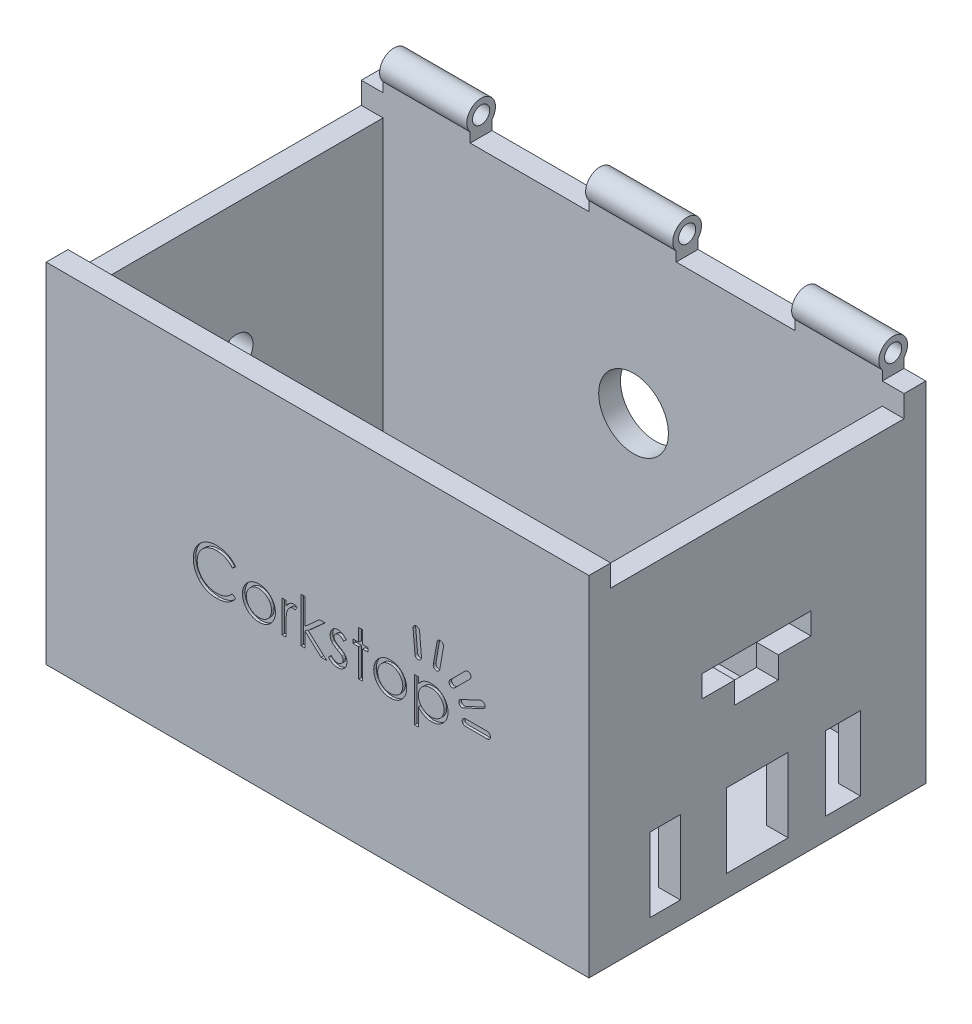
from build123d import *

# Parameters (mm, degrees)
SKETCH1_W                   = 158.2
SKETCH1_H                   = 98.2
BOSS_EXTRUDE1_DEPTH         = 6.35
SKETCH2_W                   = 158.2
SKETCH2_H                   = 95.25
BOSS_EXTRUDE2_DEPTH         = 6.35
SKETCH3_W                   = 85.5
SKETCH3_H                   = 95.25
BOSS_EXTRUDE3_DEPTH         = 6.35
SKETCH4_W                   = 158.2
SKETCH4_H                   = 95.25
BOSS_EXTRUDE4_DEPTH         = 6.35
SKETCH5_W                   = 85.5
SKETCH5_H                   = 73.66
BOSS_EXTRUDE5_DEPTH         = 6.35
SKETCH6_W                   = 13.462
SKETCH6_H                   = 21.59
SKETCH6_W_2                 = 10.922
SKETCH6_W_3                 = 11.43
SKETCH6_W_4                 = 12.7
BOSS_EXTRUDE6_DEPTH         = 6.35
KES_EKSTR_ZYON1_DEPTH       = 6.35
IZIM3_R                     = 10.16
KES_EKSTR_ZYON2_DEPTH       = 6.35
IZIM4_R                     = 4.826
KES_EKSTR_ZYON3_DEPTH       = 6.35
IZIM5_W                     = 85.5
IZIM5_H                     = 6.35
KES_EKSTR_ZYON4_DEPTH       = 6.35
IZIM6_W                     = 85.5
IZIM6_H                     = 6.35
KES_EKSTR_ZYON5_DEPTH       = 6.35
KES_EKSTR_ZYON6_DEPTH       = 0.762
KES_EKSTR_ZYON7_DEPTH       = 0.762
KES_EKSTR_ZYON8_DEPTH       = 0.762
KES_EKSTR_ZYON9_DEPTH       = 0.762
KES_EKSTR_ZYON12_DEPTH      = 0.762
KES_EKSTR_ZYON13_DEPTH      = 0.762
Y_KSEKLIK_EKSTR_ZYON2_DEPTH = 25.4
Y_KSEKLIK_EKSTR_ZYON3_DEPTH = 25.4
Y_KSEKLIK_EKSTR_ZYON4_DEPTH = 25.4
Y_KSEKLIK_EKSTR_ZYON5_DEPTH = 12.7
IZIM24_R                    = 2.5
KES_EKSTR_ZYON14_DEPTH      = 25.4
IZIM25_R                    = 2.5
KES_EKSTR_ZYON15_DEPTH      = 25.4
IZIM26_R                    = 2.5
KES_EKSTR_ZYON16_DEPTH      = 25.4


with BuildPart() as part:
    # Sketch1 → Boss-Extrude1 (new body)
    with BuildSketch(Plane(origin=(0, 0, 0), x_dir=(1, 0, 0), z_dir=(0, 1, 0))):
        Rectangle(SKETCH1_W, SKETCH1_H)
    extrude(amount=BOSS_EXTRUDE1_DEPTH)

    # Sketch2 → Boss-Extrude2 (add)
    with BuildSketch(Plane.XY.offset(49.1)):
        with Locations((0, 53.975)):
            Rectangle(SKETCH2_W, SKETCH2_H)
    extrude(amount=-BOSS_EXTRUDE2_DEPTH)

    # Sketch3 → Boss-Extrude3 (add)
    with BuildSketch(Plane.ZY.offset(79.1)):
        with Locations((0, 53.975)):
            Rectangle(SKETCH3_W, SKETCH3_H)
    extrude(amount=-BOSS_EXTRUDE3_DEPTH)

    # Sketch4 → Boss-Extrude4 (add)
    with BuildSketch(Plane(origin=(0, 0, -49.1), x_dir=(-1, 0, 0), z_dir=(0, 0, -1))):
        with Locations((0, 53.975)):
            Rectangle(SKETCH4_W, SKETCH4_H)
    extrude(amount=-BOSS_EXTRUDE4_DEPTH)

    # Sketch5 → Boss-Extrude5 (add)
    with BuildSketch(Plane(origin=(79.1, 0, 0), x_dir=(0, 0, -1), z_dir=(1, 0, 0))):
        with Locations((0, 64.77)):
            Rectangle(SKETCH5_W, SKETCH5_H)
    extrude(amount=-BOSS_EXTRUDE5_DEPTH)

    # Sketch6 → Boss-Extrude6 (add)
    with BuildSketch(Plane(origin=(79.1, 0, 0), x_dir=(0, 0, -1), z_dir=(1, 0, 0))):
        with Locations((-15.699, 17.145)):
            Rectangle(SKETCH6_W, SKETCH6_H)
        with Locations((14.429, 17.145)):
            Rectangle(SKETCH6_W_2, SKETCH6_H)
        with Locations((-37.035, 17.145)):
            Rectangle(SKETCH6_W_3, SKETCH6_H)
        with Locations((36.4, 17.145)):
            Rectangle(SKETCH6_W_4, SKETCH6_H)
    extrude(amount=-BOSS_EXTRUDE6_DEPTH)

    # Çizim2 → Kes-Ekstrüzyon1 (cut)
    with BuildSketch(Plane(origin=(79.1, 0, 0), x_dir=(0, 0, -1), z_dir=(1, 0, 0))):
        Polygon((-16.125, 60.325), (15.625, 60.325), (15.625, 53.975), (6.10000009, 53.975), (6.10000009, 47.625), (-6.59999991, 47.625), (-6.59999991, 53.975), (-16.125, 53.975), align=None)
    extrude(amount=-KES_EKSTR_ZYON1_DEPTH, mode=Mode.SUBTRACT)

    # Çizim3 → Kes-Ekstrüzyon2 (cut)
    with BuildSketch(Plane(origin=(0, 0, -49.1), x_dir=(-1, 0, 0), z_dir=(0, 0, -1))):
        with Locations((-0.250018, 57.15)):
            Circle(IZIM3_R)
    extrude(amount=-KES_EKSTR_ZYON2_DEPTH, mode=Mode.SUBTRACT)

    # Çizim4 → Kes-Ekstrüzyon3 (cut)
    with BuildSketch(Plane.ZY.offset(79.1)):
        with Locations((0, 57.15)):
            Circle(IZIM4_R)
    extrude(amount=-KES_EKSTR_ZYON3_DEPTH, mode=Mode.SUBTRACT)

    # Çizim5 → Kes-Ekstrüzyon4 (cut)
    with BuildSketch(Plane(origin=(79.1, 0, 0), x_dir=(0, 0, -1), z_dir=(1, 0, 0))):
        with Locations((0, 98.425)):
            Rectangle(IZIM5_W, IZIM5_H)
    extrude(amount=-KES_EKSTR_ZYON4_DEPTH, mode=Mode.SUBTRACT)

    # Çizim6 → Kes-Ekstrüzyon5 (cut)
    with BuildSketch(Plane.ZY.offset(79.1)):
        with Locations((0, 98.425)):
            Rectangle(IZIM6_W, IZIM6_H)
    extrude(amount=-KES_EKSTR_ZYON5_DEPTH, mode=Mode.SUBTRACT)

    # Çizim7 → Kes-Ekstrüzyon6 (cut)
    # profile 1 of 8: a face of its own
    with BuildSketch(Plane.XY.offset(49.1)):
        with BuildLine():
            Line((-23.838717949, 52.27963141), (-24.83599359, 51.516410256))
            add(Edge.make_bspline(
                [(-24.83599359, 51.516410256), (-24.907134956, 51.601195347), (-25.048458549, 51.769622441), (-25.275821941, 52.006131074), (-25.512773616, 52.227710737), (-25.759222999, 52.435416986), (-26.01960609, 52.621986393), (-26.287615274, 52.797141538), (-26.567733895, 52.954141615), (-26.955090189, 53.144507308), (-27.461812381, 53.343157642), (-28.099696512, 53.509720795), (-28.765579641, 53.615751919), (-29.219868074, 53.627235772), (-29.4509375, 53.633076923)],
                knots=[0, 0, 0, 0, 0.757959112, 1.505699292, 2.245454638, 2.979532153, 3.711538275, 4.438200793, 5.171680507, 5.909471876, 7.393775596, 8.890124382, 10.418191784, 12, 12, 12, 12], degree=3))
            add(Edge.make_bspline(
                [(-29.4509375, 53.633076923), (-29.578239758, 53.631611116), (-29.831662788, 53.628693107), (-30.207758677, 53.590197138), (-30.576831749, 53.536090747), (-30.938641926, 53.455807432), (-31.292728661, 53.354306785), (-31.641406806, 53.233020283), (-31.979628125, 53.082961293), (-32.312071447, 52.917105607), (-32.630584584, 52.729771736), (-32.931955757, 52.525434716), (-33.215085812, 52.306381138), (-33.480198719, 52.07178998), (-33.727565503, 51.822717724), (-33.955393745, 51.55650997), (-34.162895091, 51.274017797), (-34.354182582, 50.97896629), (-34.525497357, 50.672214875), (-34.668934348, 50.352628191), (-34.795952934, 50.025679017), (-34.896461615, 49.687673376), (-34.97601629, 49.340989626), (-35.030908097, 48.984697338), (-35.068966264, 48.619540843), (-35.071869763, 48.37203848), (-35.073333333, 48.247279647)],
                knots=[0, 0, 0, 0, 1.054917814, 2.100044995, 3.131103042, 4.146048494, 5.169673617, 6.183595914, 7.203665975, 8.234915748, 9.262203917, 10.264457458, 11.251630812, 12.227803204, 13.197192746, 14.159520551, 15.12972552, 16.100847026, 17.073214652, 18.039054194, 19.002613845, 19.979014051, 20.95965708, 21.949030935, 22.966165397, 24, 24, 24, 24], degree=3))
            add(Edge.make_bspline(
                [(-35.073333333, 48.247279647), (-35.068754733, 48.059568858), (-35.059765258, 47.691023622), (-34.979761303, 47.151198835), (-34.858185686, 46.63405239), (-34.675974878, 46.142816962), (-34.451297181, 45.671435206), (-34.167395533, 45.227882795), (-33.838586955, 44.805456975), (-33.460219776, 44.414141136), (-33.0450901, 44.056677047), (-32.599690535, 43.741896366), (-32.125130406, 43.479496649), (-31.62664949, 43.261143929), (-31.100411877, 43.093298089), (-30.54736388, 42.97513684), (-29.968708354, 42.898058071), (-29.573305103, 42.890678689), (-29.372071314, 42.886923077)],
                knots=[0, 0, 0, 0, 1.029171465, 2.020641659, 2.987623507, 3.938342917, 4.889210282, 5.84687017, 6.821220943, 7.821438502, 8.827599549, 9.822697543, 10.807740252, 11.797342354, 12.80366471, 13.83203677, 14.896651826, 16, 16, 16, 16], degree=3))
            add(Edge.make_bspline(
                [(-29.372071314, 42.886923077), (-29.150355843, 42.893050935), (-28.713966756, 42.905112025), (-28.074002775, 43.007289872), (-27.461370139, 43.172962888), (-26.876035897, 43.404821063), (-26.319650181, 43.706229394), (-25.791342299, 44.071618835), (-25.290666314, 44.504465071), (-24.98959909, 44.834966708), (-24.83599359, 45.003589744)],
                knots=[0, 0, 0, 0, 1.028121516, 2.023589091, 2.998037872, 3.967518031, 4.937445131, 5.927275754, 6.942489185, 8, 8, 8, 8], degree=3))
            Line((-24.83599359, 45.003589744), (-23.838717949, 44.248000801))
            add(Edge.make_bspline(
                [(-23.838717949, 44.248000801), (-23.91897509, 44.14444699), (-24.079104946, 43.937835384), (-24.338395465, 43.646563752), (-24.611544516, 43.372591966), (-24.900580949, 43.118128883), (-25.202179793, 42.87808268), (-25.521756469, 42.659273177), (-25.855109816, 42.458646254), (-26.201110353, 42.274942843), (-26.559390463, 42.111957403), (-26.929520841, 41.97242516), (-27.309906072, 41.852229133), (-27.700563545, 41.753343534), (-28.102303577, 41.676159886), (-28.51367644, 41.624562781), (-28.935569988, 41.589213548), (-29.220200287, 41.585991682), (-29.364439103, 41.584358974)],
                knots=[0, 0, 0, 0, 0.986787822, 1.968848986, 2.935600012, 3.899624008, 4.868462664, 5.837806735, 6.815139263, 7.798259679, 8.787526145, 9.778297419, 10.776456485, 11.791383307, 12.812564526, 13.85620153, 14.913611965, 16, 16, 16, 16], degree=3))
            add(Edge.make_bspline(
                [(-29.364439103, 41.584358974), (-29.501031837, 41.585309633), (-29.771127056, 41.587189443), (-30.169902526, 41.617641022), (-30.558121862, 41.65918721), (-30.934675504, 41.721744257), (-31.301618328, 41.795565148), (-31.655623877, 41.894520851), (-32.000175641, 42.005370684), (-32.333889334, 42.135654493), (-32.657048816, 42.282670355), (-32.968611789, 42.448828297), (-33.268434958, 42.632731064), (-33.559466056, 42.830324958), (-33.83740586, 43.047956882), (-34.104662938, 43.282604385), (-34.362735923, 43.533476595), (-34.522402809, 43.714378492), (-34.602680288, 43.805332532)],
                knots=[0, 0, 0, 0, 1.114604814, 2.203992996, 3.262667896, 4.300477797, 5.318619304, 6.316056647, 7.298880507, 8.271930387, 9.238335007, 10.195173496, 11.151986948, 12.108099108, 13.064862484, 14.031167946, 15.010108607, 16, 16, 16, 16], degree=3))
            add(Edge.make_bspline(
                [(-34.602680288, 43.805332532), (-34.731261052, 43.963324846), (-34.986870239, 44.277402052), (-35.31389772, 44.786439756), (-35.593833134, 45.317910114), (-35.820168618, 45.874605284), (-35.997107679, 46.455276089), (-36.119685158, 47.060215241), (-36.199338123, 47.688857774), (-36.208446885, 48.116436979), (-36.213076923, 48.333778045)],
                knots=[0, 0, 0, 0, 0.994628077, 1.977248131, 2.950237994, 3.925870899, 4.908910175, 5.911660606, 6.938484602, 8, 8, 8, 8], degree=3))
            add(Edge.make_bspline(
                [(-36.213076923, 48.333778045), (-36.207433792, 48.562216405), (-36.196331284, 49.011654617), (-36.102003684, 49.67123439), (-35.950261195, 50.30315518), (-35.734735342, 50.906237339), (-35.461484496, 51.483652928), (-35.123930783, 52.030991014), (-34.725995724, 52.551751972), (-34.270800264, 53.03803407), (-33.771627361, 53.482676864), (-33.237070522, 53.873859375), (-32.668176029, 54.19940579), (-32.071211253, 54.471534722), (-31.441706066, 54.680701774), (-30.781003555, 54.827126194), (-30.090345207, 54.918265445), (-29.619130119, 54.929786913), (-29.379703526, 54.935641026)],
                knots=[0, 0, 0, 0, 1.032925535, 2.032216505, 3.007276963, 3.968222605, 4.92396291, 5.891752235, 6.871517503, 7.883894988, 8.900124299, 9.891468569, 10.874487609, 11.85992873, 12.854644235, 13.869047385, 14.917252991, 16, 16, 16, 16], degree=3))
            add(Edge.make_bspline(
                [(-29.379703526, 54.935641026), (-29.233782442, 54.933891553), (-28.944946352, 54.930428647), (-28.517672441, 54.896660646), (-28.101684569, 54.840368418), (-27.696696149, 54.76374725), (-27.300736941, 54.668652112), (-26.91683321, 54.544771601), (-26.542732261, 54.403124759), (-26.18079348, 54.239989754), (-25.832753426, 54.056867578), (-25.498720499, 53.85578803), (-25.181348012, 53.637000393), (-24.878402762, 53.402365442), (-24.59495251, 53.146919241), (-24.322949431, 52.877687964), (-24.071630662, 52.586916659), (-23.91649764, 52.382247328), (-23.838717949, 52.27963141)],
                knots=[0, 0, 0, 0, 1.096760587, 2.17092713, 3.219439832, 4.250915756, 5.268269357, 6.278326846, 7.281116186, 8.274029601, 9.260640565, 10.235837813, 11.203064059, 12.156899882, 13.114053108, 14.069676657, 15.032185724, 16, 16, 16, 16], degree=3))
        make_face()
    # profile 2 of 8: a face of its own
    with BuildSketch(Plane.XY.offset(49.1)):
        with BuildLine():
            add(Edge.make_bspline(
                [(-17.076578526, 51.353589744), (-16.902438764, 51.349881739), (-16.56099325, 51.342611247), (-16.060947492, 51.264905514), (-15.58362657, 51.146079364), (-15.127202387, 50.981808267), (-14.697520401, 50.761619475), (-14.288321887, 50.49887719), (-13.90072874, 50.187608922), (-13.668416605, 49.946823931), (-13.550496795, 49.824603365)],
                knots=[0, 0, 0, 0, 1.054011418, 2.066658804, 3.057071809, 4.030435133, 4.997543892, 5.974964718, 6.972108034, 8, 8, 8, 8], degree=3))
            add(Edge.make_bspline(
                [(-13.550496795, 49.824603365), (-13.448962276, 49.707712617), (-13.24785821, 49.476193278), (-12.989991174, 49.100797197), (-12.76784437, 48.712031689), (-12.589815911, 48.304734246), (-12.44944454, 47.88246044), (-12.349783299, 47.443758856), (-12.290503564, 46.989598339), (-12.282509941, 46.681155841), (-12.278461538, 46.52494391)],
                knots=[0, 0, 0, 0, 1.025258237, 2.030674902, 3.01204498, 3.988269485, 4.97094183, 5.956517959, 6.965070386, 8, 8, 8, 8], degree=3))
            add(Edge.make_bspline(
                [(-12.278461538, 46.52494391), (-12.282022391, 46.367826558), (-12.289058802, 46.057355343), (-12.355619924, 45.600085073), (-12.459147007, 45.15669243), (-12.607308248, 44.729033742), (-12.797293388, 44.315801768), (-13.029125311, 43.918801403), (-13.304430893, 43.537249377), (-13.616502539, 43.174385564), (-13.961405061, 42.83995387), (-14.33556937, 42.548477006), (-14.731642579, 42.298753189), (-15.154891318, 42.097598196), (-15.601450484, 41.938994426), (-16.072283274, 41.827597223), (-16.566658244, 41.760244828), (-16.904214161, 41.751595862), (-17.076578526, 41.747179487)],
                knots=[0, 0, 0, 0, 0.998656419, 1.973391657, 2.932242238, 3.890759089, 4.846373663, 5.82037756, 6.809684879, 7.83454468, 8.860553229, 9.859544525, 10.845671541, 11.83227036, 12.833544569, 13.85385346, 14.904124723, 16, 16, 16, 16], degree=3))
            add(Edge.make_bspline(
                [(-17.076578526, 41.747179487), (-17.249787365, 41.751610685), (-17.589025627, 41.760289409), (-18.085145619, 41.82733555), (-18.556822236, 41.938943086), (-19.003966008, 42.098119417), (-19.429034453, 42.298759619), (-19.827402599, 42.547722035), (-20.201870864, 42.840040313), (-20.54684635, 43.174362142), (-20.858898432, 43.537255412), (-21.134209062, 43.918799837), (-21.366039674, 44.315802176), (-21.556025157, 44.729033633), (-21.704186307, 45.15669246), (-21.807713415, 45.600085065), (-21.87427453, 46.057355345), (-21.881310942, 46.367826559), (-21.884871795, 46.52494391)],
                knots=[0, 0, 0, 0, 1.099876186, 2.154163076, 3.173186993, 4.173200201, 5.163417411, 6.152872554, 7.150605724, 8.17532212, 9.198891216, 10.186952605, 11.159729845, 12.11414092, 13.071450619, 14.029093627, 15.002601286, 16, 16, 16, 16], degree=3))
            add(Edge.make_bspline(
                [(-21.884871795, 46.52494391), (-21.880795783, 46.680306805), (-21.87272598, 46.987898637), (-21.813505847, 47.4412054), (-21.714233371, 47.879164497), (-21.573693732, 48.299808367), (-21.394024325, 48.70532095), (-21.17499908, 49.095047051), (-20.914501642, 49.468745641), (-20.714197418, 49.69996576), (-20.612836538, 49.816971154)],
                knots=[0, 0, 0, 0, 1.031353054, 2.041901799, 3.029428768, 4.008703097, 4.981709435, 5.96992636, 6.972712378, 8, 8, 8, 8], degree=3))
            add(Edge.make_bspline(
                [(-20.612836538, 49.816971154), (-20.495094508, 49.940251648), (-20.263534088, 50.182704431), (-19.874011562, 50.493065304), (-19.465819696, 50.761275058), (-19.03138925, 50.977088754), (-18.575340023, 51.147045661), (-18.095573057, 51.265211959), (-17.593830472, 51.342331276), (-17.250714133, 51.349799521), (-17.076578526, 51.353589744)],
                knots=[0, 0, 0, 0, 1.027980169, 2.021703884, 2.998553061, 3.971491411, 4.943284454, 5.930300938, 6.949603206, 8, 8, 8, 8], degree=3))
        make_face()
        with BuildLine():
            add(Edge.make_bspline(
                [(-17.081666667, 50.213846154), (-17.204811713, 50.210346064), (-17.447922837, 50.203436239), (-17.805771045, 50.150880356), (-18.150268175, 50.067613698), (-18.482067809, 49.949307551), (-18.800051035, 49.79654869), (-19.104522295, 49.608921211), (-19.396377148, 49.388910198), (-19.66990635, 49.136859932), (-19.920939311, 48.86152758), (-20.140387969, 48.568163535), (-20.326987641, 48.261526222), (-20.482436217, 47.94129677), (-20.598213728, 47.604230011), (-20.682298696, 47.254143149), (-20.734804997, 46.890322923), (-20.741649856, 46.6429958), (-20.745128205, 46.517311699)],
                knots=[0, 0, 0, 0, 1.021534396, 2.016698045, 2.994645724, 3.958388632, 4.93408049, 5.916473867, 6.921342795, 7.962252576, 8.998418191, 10.008913653, 10.997312074, 11.973003931, 12.956656626, 13.948281152, 14.957379055, 16, 16, 16, 16], degree=3))
            add(Edge.make_bspline(
                [(-20.745128205, 46.517311699), (-20.739297731, 46.354925772), (-20.72772533, 46.032620072), (-20.633617472, 45.557962569), (-20.476187256, 45.102279849), (-20.263599127, 44.668243248), (-19.997239419, 44.266660982), (-19.68341492, 43.908624453), (-19.325493721, 43.599521652), (-18.927742421, 43.343051155), (-18.498285324, 43.13927147), (-18.043783816, 42.994858044), (-17.569744726, 42.90098076), (-17.245783216, 42.891649982), (-17.081666667, 42.886923077)],
                knots=[0, 0, 0, 0, 1.016792936, 2.018143844, 3.017858371, 4.030088057, 5.03801393, 6.028138512, 7.003788237, 7.991172063, 8.984598303, 9.972568034, 10.972917682, 12, 12, 12, 12], degree=3))
            add(Edge.make_bspline(
                [(-17.081666667, 42.886923077), (-16.917559557, 42.891677522), (-16.59361668, 42.901062666), (-16.120236238, 42.99438524), (-15.666976969, 43.139904238), (-15.237965934, 43.342821971), (-14.840395687, 43.60049559), (-14.479900304, 43.906879015), (-14.168755344, 44.267609276), (-13.90265912, 44.668775166), (-13.686589511, 45.101606958), (-13.529896179, 45.558046672), (-13.435562081, 46.032598653), (-13.424020217, 46.354918596), (-13.418205128, 46.517311699)],
                knots=[0, 0, 0, 0, 1.02726834, 2.027799167, 3.010890988, 4.004497153, 4.992059811, 5.971914811, 6.958719428, 7.966827853, 8.981595046, 9.981490638, 10.983022906, 12, 12, 12, 12], degree=3))
            add(Edge.make_bspline(
                [(-13.418205128, 46.517311699), (-13.421682279, 46.642996551), (-13.428524782, 46.890325153), (-13.481048224, 47.254134627), (-13.565069754, 47.604261278), (-13.681081051, 47.941181404), (-13.835854187, 48.262355348), (-14.026052265, 48.567263215), (-14.244604843, 48.862543825), (-14.498666967, 49.135969893), (-14.771910652, 49.389008454), (-15.063883791, 49.609006524), (-15.36790357, 49.795724085), (-15.684962999, 49.950614158), (-16.016805173, 50.066537364), (-16.360819613, 50.151361142), (-16.717141009, 50.203214141), (-16.959380966, 50.210279483), (-17.081666667, 50.213846154)],
                knots=[0, 0, 0, 0, 1.042956736, 2.052379634, 3.044323526, 4.02829302, 5.004299113, 5.996692471, 7.007513377, 8.048758398, 9.090003419, 10.095195979, 11.07790575, 12.047570684, 13.018257071, 13.989683339, 14.985167495, 16, 16, 16, 16], degree=3))
        make_face(mode=Mode.SUBTRACT)
    # profile 3 of 8: a face of its own
    with BuildSketch(Plane.XY.offset(49.1)):
        with BuildLine():
            Line((-10.324615385, 51.190769231), (-9.184871795, 51.190769231))
            Line((-9.184871795, 51.190769231), (-9.184871795, 49.824603365))
            add(Edge.make_bspline(
                [(-9.184871795, 49.824603365), (-9.100729727, 49.951805942), (-8.939808677, 50.195079883), (-8.672336048, 50.516822775), (-8.398366817, 50.783214515), (-8.116589423, 50.995498712), (-7.824931746, 51.154477743), (-7.529794807, 51.270929613), (-7.226535245, 51.339790157), (-7.022747692, 51.34898372), (-6.920649038, 51.353589744)],
                knots=[0, 0, 0, 0, 1.2804753, 2.448899062, 3.506932113, 4.484331642, 5.4025378, 6.288909075, 7.142734305, 8, 8, 8, 8], degree=3))
            add(Edge.make_bspline(
                [(-6.920649038, 51.353589744), (-6.841450654, 51.349269833), (-6.67849483, 51.340381336), (-6.431815147, 51.277930629), (-6.177657479, 51.178224662), (-6.013855102, 51.084461568), (-5.928461538, 51.035580929)],
                knots=[0, 0, 0, 0, 0.901110191, 1.854092781, 2.881294221, 4, 4, 4, 4], degree=3))
            Line((-5.928461538, 51.035580929), (-6.554302885, 50.048481571))
            add(Edge.make_bspline(
                [(-6.554302885, 50.048481571), (-6.609127047, 50.072939108), (-6.713193803, 50.119364195), (-6.865428943, 50.17430806), (-7.005786936, 50.206660098), (-7.095207848, 50.211561272), (-7.136895032, 50.213846154)],
                knots=[0, 0, 0, 0, 1.180555205, 2.24091978, 3.179933427, 4, 4, 4, 4], degree=3))
            add(Edge.make_bspline(
                [(-7.136895032, 50.213846154), (-7.228355837, 50.207750018), (-7.414909366, 50.195315669), (-7.688810264, 50.097566281), (-7.954592981, 49.939631838), (-8.165673013, 49.764476661), (-8.329112045, 49.595574653), (-8.445735149, 49.44807902), (-8.552715402, 49.2826937), (-8.654933059, 49.102245991), (-8.748065041, 48.903654835), (-8.834986269, 48.688904318), (-8.913577, 48.457745708), (-8.958390743, 48.296700563), (-8.981346154, 48.214206731)],
                knots=[0, 0, 0, 0, 1.125678352, 2.296057538, 3.5422874, 4.923748041, 5.663163013, 6.437101912, 7.23742474, 8.08941207, 8.991984279, 9.93940061, 10.944477711, 12, 12, 12, 12], degree=3))
            add(Edge.make_bspline(
                [(-8.981346154, 48.214206731), (-8.998517981, 48.140629558), (-9.036552274, 47.977661712), (-9.073532997, 47.704254208), (-9.110070962, 47.381225503), (-9.135821549, 47.007676437), (-9.159690444, 46.584539855), (-9.173152743, 46.111171138), (-9.18441271, 45.587084407), (-9.184714124, 45.220691754), (-9.184871795, 45.029030449)],
                knots=[0, 0, 0, 0, 0.566838948, 1.255505196, 2.06880316, 3.007127437, 4.065329342, 5.249902469, 6.561414163, 8, 8, 8, 8], degree=3))
            Line((-9.184871795, 45.029030449), (-9.184871795, 41.91))
            Line((-9.184871795, 41.91), (-10.324615385, 41.91))
            Line((-10.324615385, 41.91), (-10.324615385, 51.190769231))
        make_face()
    # profile 4 of 8: a face of its own
    with BuildSketch(Plane.XY.offset(49.1)):
        Polygon((-4.788717949, 54.935641026), (-3.648974359, 54.935641026), (-3.648974359, 47.405192308), (0.574182692, 51.190769231), (2.212564103, 51.190769231), (-2.687315705, 46.794615385), (2.701025641, 41.91), (1.065188301, 41.91), (-3.648974359, 46.186582532), (-3.648974359, 41.91), (-4.788717949, 41.91), align=None)
    # profile 5 of 8: a face of its own
    with BuildSketch(Plane.XY.offset(49.1)):
        with BuildLine():
            Line((8.39974359, 50.033217147), (7.626346154, 49.236923077))
            add(Edge.make_bspline(
                [(7.626346154, 49.236923077), (7.559614898, 49.314259351), (7.430964893, 49.463354582), (7.226924948, 49.662697652), (7.023639301, 49.830108831), (6.823890748, 49.971449884), (6.622656458, 50.078308216), (6.422297926, 50.156303858), (6.222607704, 50.20457041), (6.089126947, 50.210791374), (6.023581731, 50.213846154)],
                knots=[0, 0, 0, 0, 1.26578478, 2.440284043, 3.530471711, 4.527705817, 5.468200915, 6.346673037, 7.188140097, 8, 8, 8, 8], degree=3))
            add(Edge.make_bspline(
                [(6.023581731, 50.213846154), (5.943247373, 50.2099459), (5.785160727, 50.202270754), (5.558644186, 50.125659164), (5.348366204, 50.008061741), (5.16636802, 49.841261452), (5.012198438, 49.649802534), (4.899663081, 49.435730155), (4.830843655, 49.205504397), (4.822117913, 49.045738913), (4.817692308, 48.964707532)],
                knots=[0, 0, 0, 0, 0.99966794, 1.967205029, 2.953328237, 3.988086729, 5.028030931, 6.008226631, 6.989793394, 8, 8, 8, 8], degree=3))
            add(Edge.make_bspline(
                [(4.817692308, 48.964707532), (4.821722969, 48.891366686), (4.82977293, 48.744891741), (4.892353738, 48.528817447), (4.992016342, 48.318153337), (5.085162476, 48.189110791), (5.133157051, 48.122620192)],
                knots=[0, 0, 0, 0, 0.960159726, 1.917612774, 2.927026955, 4, 4, 4, 4], degree=3))
            add(Edge.make_bspline(
                [(5.133157051, 48.122620192), (5.162053157, 48.087116129), (5.223554877, 48.011550205), (5.338974346, 47.906670509), (5.46968457, 47.79076577), (5.626874059, 47.674880675), (5.803770645, 47.552845558), (6.004210334, 47.42946639), (6.221832109, 47.295338334), (6.377633193, 47.210268525), (6.458617788, 47.166049679)],
                knots=[0, 0, 0, 0, 0.66740084, 1.420478572, 2.27185888, 3.217733974, 4.268547843, 5.408967954, 6.65319498, 8, 8, 8, 8], degree=3))
            add(Edge.make_bspline(
                [(6.458617788, 47.166049679), (6.557364197, 47.110732461), (6.748109742, 47.003877809), (7.019137784, 46.838016885), (7.265107904, 46.673165717), (7.488104183, 46.511087323), (7.68383589, 46.347246918), (7.858241552, 46.187924485), (8.006971049, 46.028306138), (8.090261011, 45.91678884), (8.130072115, 45.863485577)],
                knots=[0, 0, 0, 0, 1.27191281, 2.456916733, 3.569705269, 4.599008579, 5.553216877, 6.436649441, 7.252746552, 8, 8, 8, 8], degree=3))
            add(Edge.make_bspline(
                [(8.130072115, 45.863485577), (8.196150315, 45.755840057), (8.327658196, 45.541605495), (8.465755334, 45.188841487), (8.545802617, 44.814697664), (8.556914102, 44.558766465), (8.562564103, 44.428629808)],
                knots=[0, 0, 0, 0, 0.995354457, 1.980940102, 2.973342416, 4, 4, 4, 4], degree=3))
            add(Edge.make_bspline(
                [(8.562564103, 44.428629808), (8.559953223, 44.336938906), (8.554808199, 44.156251967), (8.519037499, 43.890151299), (8.457515156, 43.635663047), (8.37371782, 43.390025871), (8.260563096, 43.15794629), (8.127946803, 42.933569044), (7.968743552, 42.721747809), (7.786983418, 42.522760725), (7.587972625, 42.341021013), (7.375678923, 42.181276952), (7.149840881, 42.048564357), (6.912072201, 41.93874439), (6.661832657, 41.851410997), (6.399083121, 41.790949812), (6.124658783, 41.754762936), (5.938042051, 41.749739265), (5.842952724, 41.747179487)],
                knots=[0, 0, 0, 0, 1.032770009, 2.035186124, 3.017557409, 3.978232242, 4.952395191, 5.920591857, 6.910227898, 7.931268572, 8.952309245, 9.941945286, 10.918353717, 11.897095711, 12.887975737, 13.898235213, 14.929059601, 16, 16, 16, 16], degree=3))
            add(Edge.make_bspline(
                [(5.842952724, 41.747179487), (5.714620402, 41.750781571), (5.459738924, 41.757935689), (5.082767658, 41.825086253), (4.714392333, 41.929572397), (4.35740063, 42.073684501), (4.01977616, 42.255659945), (3.710872519, 42.47360063), (3.429616641, 42.720307192), (3.269530333, 42.909402611), (3.189487179, 43.003950321)],
                knots=[0, 0, 0, 0, 1.013940152, 2.01379169, 3.017749504, 4.037548394, 5.051665909, 6.043208538, 7.021604269, 8, 8, 8, 8], degree=3))
            Line((3.189487179, 43.003950321), (3.945076122, 43.863846154))
            add(Edge.make_bspline(
                [(3.945076122, 43.863846154), (4.016821735, 43.786358865), (4.155911453, 43.63613804), (4.378347297, 43.436115433), (4.60469541, 43.26847082), (4.832695558, 43.12825043), (5.065722757, 43.020208252), (5.302471129, 42.94430364), (5.542459125, 42.895520429), (5.703648018, 42.889793518), (5.784439103, 42.886923077)],
                knots=[0, 0, 0, 0, 1.179806542, 2.287233372, 3.337373186, 4.324005949, 5.273901747, 6.200048787, 7.097828587, 8, 8, 8, 8], degree=3))
            add(Edge.make_bspline(
                [(5.784439103, 42.886923077), (5.894449862, 42.891897213), (6.109392433, 42.90161584), (6.417254072, 42.989852145), (6.701511373, 43.128209399), (6.948338941, 43.32445959), (7.158441069, 43.552898382), (7.310580444, 43.810215329), (7.405925424, 44.088858615), (7.417123191, 44.282015827), (7.422820513, 44.380292468)],
                knots=[0, 0, 0, 0, 1.072336372, 2.095165389, 3.102688358, 4.141489647, 5.156069229, 6.117746104, 7.042326257, 8, 8, 8, 8], degree=3))
            add(Edge.make_bspline(
                [(7.422820513, 44.380292468), (7.418878816, 44.461244513), (7.411096464, 44.621073489), (7.349979448, 44.852396155), (7.253412813, 45.071813259), (7.158327375, 45.200227122), (7.10989984, 45.265629006)],
                knots=[0, 0, 0, 0, 1.013901739, 2.00181326, 2.98231254, 4, 4, 4, 4], degree=3))
            add(Edge.make_bspline(
                [(7.10989984, 45.265629006), (7.080790009, 45.298414463), (7.017378283, 45.36983303), (6.90106355, 45.472975459), (6.761792222, 45.58414799), (6.597997916, 45.70146547), (6.40935044, 45.823380409), (6.195085201, 45.949253201), (5.958137481, 46.085062378), (5.790604048, 46.17512227), (5.703028846, 46.222199519)],
                knots=[0, 0, 0, 0, 0.615000592, 1.339693406, 2.178160186, 3.116406724, 4.166410947, 5.330106347, 6.604359322, 8, 8, 8, 8], degree=3))
            add(Edge.make_bspline(
                [(5.703028846, 46.222199519), (5.608516752, 46.274955797), (5.42522764, 46.377267056), (5.165613184, 46.53661969), (4.931398499, 46.698698087), (4.716947843, 46.854410389), (4.527677908, 47.011966386), (4.364334324, 47.171540984), (4.220486084, 47.326698648), (4.140848333, 47.436634553), (4.102808494, 47.489146635)],
                knots=[0, 0, 0, 0, 1.262093308, 2.447601706, 3.550203992, 4.582594899, 5.537233252, 6.418365656, 7.244515135, 8, 8, 8, 8], degree=3))
            add(Edge.make_bspline(
                [(4.102808494, 47.489146635), (4.037020318, 47.594903581), (3.905420976, 47.80645443), (3.777640139, 48.159552446), (3.689806834, 48.531281654), (3.681960447, 48.787773954), (3.677948718, 48.918914263)],
                knots=[0, 0, 0, 0, 0.985009483, 1.970363186, 2.962279964, 4, 4, 4, 4], degree=3))
            add(Edge.make_bspline(
                [(3.677948718, 48.918914263), (3.679887084, 49.004640707), (3.68368074, 49.172419503), (3.713957728, 49.418940365), (3.769081937, 49.653157952), (3.838224085, 49.878589712), (3.934319558, 50.090868739), (4.049148985, 50.292825848), (4.184086213, 50.484181894), (4.339546154, 50.661993259), (4.510475981, 50.823498529), (4.695151288, 50.964282121), (4.889418676, 51.084410895), (5.094100656, 51.185158763), (5.311163515, 51.26136378), (5.539090002, 51.313823434), (5.777418764, 51.348858027), (5.940345707, 51.35198979), (6.023581731, 51.353589744)],
                knots=[0, 0, 0, 0, 1.087655834, 2.128696564, 3.144119009, 4.137814668, 5.115653402, 6.093965665, 7.082169637, 8.081268856, 9.086088321, 10.061021666, 11.022561449, 11.980240094, 12.950172527, 13.934149372, 14.944599409, 16, 16, 16, 16], degree=3))
            add(Edge.make_bspline(
                [(6.023581731, 51.353589744), (6.122250075, 51.349582564), (6.32143768, 51.341493036), (6.620267323, 51.277246673), (6.918656879, 51.171535124), (7.217373034, 51.025535077), (7.514227513, 50.836606699), (7.811831536, 50.608263241), (8.113757817, 50.342006963), (8.30228501, 50.138446916), (8.39974359, 50.033217147)],
                knots=[0, 0, 0, 0, 0.845714091, 1.707292901, 2.609013841, 3.555613372, 4.552488639, 5.621697636, 6.770543573, 8, 8, 8, 8], degree=3))
        make_face()
    # profile 6 of 8: a face of its own
    with BuildSketch(Plane.XY.offset(49.1)):
        Polygon((11.981794872, 54.935641026), (13.121538462, 54.935641026), (13.121538462, 51.190769231), (14.74974359, 51.190769231), (14.74974359, 50.051025641), (13.121538462, 50.051025641), (13.121538462, 41.91), (11.981794872, 41.91), (11.981794872, 50.051025641), (10.353589744, 50.051025641), (10.353589744, 51.190769231), (11.981794872, 51.190769231), align=None)
    # profile 7 of 8: a face of its own
    with BuildSketch(Plane.XY.offset(49.1)):
        with BuildLine():
            add(Edge.make_bspline(
                [(21.186241987, 51.353589744), (21.360381749, 51.349881739), (21.701827263, 51.342611247), (22.201873021, 51.264905514), (22.679193942, 51.146079364), (23.135618125, 50.981808267), (23.565300112, 50.761619475), (23.974498626, 50.49887719), (24.362091773, 50.187608922), (24.594403907, 49.946823931), (24.712323718, 49.824603365)],
                knots=[0, 0, 0, 0, 1.054011418, 2.066658804, 3.057071809, 4.030435133, 4.997543892, 5.974964718, 6.972108034, 8, 8, 8, 8], degree=3))
            add(Edge.make_bspline(
                [(24.712323718, 49.824603365), (24.813858237, 49.707712617), (25.014962302, 49.476193278), (25.272829339, 49.100797197), (25.494976143, 48.712031689), (25.673004602, 48.304734246), (25.813375973, 47.88246044), (25.913037214, 47.443758856), (25.972316949, 46.989598339), (25.980310572, 46.681155841), (25.984358974, 46.52494391)],
                knots=[0, 0, 0, 0, 1.025258237, 2.030674902, 3.01204498, 3.988269485, 4.97094183, 5.956517959, 6.965070386, 8, 8, 8, 8], degree=3))
            add(Edge.make_bspline(
                [(25.984358974, 46.52494391), (25.980798122, 46.367826558), (25.973761711, 46.057355343), (25.907200589, 45.600085073), (25.803673506, 45.15669243), (25.655512264, 44.729033742), (25.465527125, 44.315801768), (25.233695202, 43.918801403), (24.958389619, 43.537249377), (24.646317974, 43.174385564), (24.301415452, 42.83995387), (23.927251142, 42.548477006), (23.531177934, 42.298753189), (23.107929195, 42.097598196), (22.661370029, 41.938994426), (22.190537239, 41.827597223), (21.696162269, 41.760244828), (21.358606352, 41.751595862), (21.186241987, 41.747179487)],
                knots=[0, 0, 0, 0, 0.998656419, 1.973391657, 2.932242238, 3.890759089, 4.846373663, 5.82037756, 6.809684879, 7.83454468, 8.860553229, 9.859544525, 10.845671541, 11.83227036, 12.833544569, 13.85385346, 14.904124723, 16, 16, 16, 16], degree=3))
            add(Edge.make_bspline(
                [(21.186241987, 41.747179487), (21.013033148, 41.751610685), (20.673794885, 41.760289409), (20.177674894, 41.82733555), (19.705998277, 41.938943086), (19.258854505, 42.098119417), (18.83378606, 42.298759619), (18.435417914, 42.547722035), (18.060949649, 42.840040313), (17.715974163, 43.174362142), (17.403922081, 43.537255412), (17.12861145, 43.918799837), (16.896780838, 44.315802176), (16.706795356, 44.729033633), (16.558634206, 45.15669246), (16.455107098, 45.600085065), (16.388545983, 46.057355345), (16.381509571, 46.367826559), (16.377948718, 46.52494391)],
                knots=[0, 0, 0, 0, 1.099876186, 2.154163076, 3.173186993, 4.173200201, 5.163417411, 6.152872554, 7.150605724, 8.17532212, 9.198891216, 10.186952605, 11.159729845, 12.11414092, 13.071450619, 14.029093627, 15.002601286, 16, 16, 16, 16], degree=3))
            add(Edge.make_bspline(
                [(16.377948718, 46.52494391), (16.38202473, 46.680306805), (16.390094533, 46.987898637), (16.449314666, 47.4412054), (16.548587142, 47.879164497), (16.689126781, 48.299808367), (16.868796188, 48.70532095), (17.087821432, 49.095047051), (17.34831887, 49.468745641), (17.548623095, 49.69996576), (17.649983974, 49.816971154)],
                knots=[0, 0, 0, 0, 1.031353054, 2.041901799, 3.029428768, 4.008703097, 4.981709435, 5.96992636, 6.972712378, 8, 8, 8, 8], degree=3))
            add(Edge.make_bspline(
                [(17.649983974, 49.816971154), (17.767726005, 49.940251648), (17.999286425, 50.182704431), (18.388808951, 50.493065304), (18.797000816, 50.761275058), (19.231431263, 50.977088754), (19.68748049, 51.147045661), (20.167247456, 51.265211959), (20.668990041, 51.342331276), (21.01210638, 51.349799521), (21.186241987, 51.353589744)],
                knots=[0, 0, 0, 0, 1.027980169, 2.021703884, 2.998553061, 3.971491411, 4.943284454, 5.930300938, 6.949603206, 8, 8, 8, 8], degree=3))
        make_face()
        with BuildLine():
            add(Edge.make_bspline(
                [(21.181153846, 50.213846154), (21.058008799, 50.210346064), (20.814897675, 50.203436239), (20.457049468, 50.150880356), (20.112552338, 50.067613698), (19.780752704, 49.949307551), (19.462769478, 49.79654869), (19.158298218, 49.608921211), (18.866443364, 49.388910198), (18.592914163, 49.136859932), (18.341881202, 48.86152758), (18.122432544, 48.568163535), (17.935832872, 48.261526222), (17.780384295, 47.94129677), (17.664606784, 47.604230011), (17.580521817, 47.254143149), (17.528015516, 46.890322923), (17.521170657, 46.6429958), (17.517692308, 46.517311699)],
                knots=[0, 0, 0, 0, 1.021534396, 2.016698045, 2.994645724, 3.958388632, 4.93408049, 5.916473867, 6.921342795, 7.962252576, 8.998418191, 10.008913653, 10.997312074, 11.973003931, 12.956656626, 13.948281152, 14.957379055, 16, 16, 16, 16], degree=3))
            add(Edge.make_bspline(
                [(17.517692308, 46.517311699), (17.523522782, 46.354925772), (17.535095183, 46.032620072), (17.629203041, 45.557962569), (17.786633257, 45.102279849), (17.999221386, 44.668243248), (18.265581094, 44.266660982), (18.579405593, 43.908624453), (18.937326791, 43.599521652), (19.335078092, 43.343051155), (19.764535188, 43.13927147), (20.219036697, 42.994858044), (20.693075786, 42.90098076), (21.017037297, 42.891649982), (21.181153846, 42.886923077)],
                knots=[0, 0, 0, 0, 1.016792936, 2.018143844, 3.017858371, 4.030088057, 5.03801393, 6.028138512, 7.003788237, 7.991172063, 8.984598303, 9.972568034, 10.972917682, 12, 12, 12, 12], degree=3))
            add(Edge.make_bspline(
                [(21.181153846, 42.886923077), (21.345260956, 42.891677522), (21.669203833, 42.901062666), (22.142584275, 42.99438524), (22.595843544, 43.139904238), (23.024854579, 43.342821971), (23.422424826, 43.60049559), (23.782920209, 43.906879015), (24.094065169, 44.267609276), (24.360161393, 44.668775166), (24.576231002, 45.101606958), (24.732924334, 45.558046672), (24.827258431, 46.032598653), (24.838800296, 46.354918596), (24.844615385, 46.517311699)],
                knots=[0, 0, 0, 0, 1.02726834, 2.027799167, 3.010890988, 4.004497153, 4.992059811, 5.971914811, 6.958719428, 7.966827853, 8.981595046, 9.981490638, 10.983022906, 12, 12, 12, 12], degree=3))
            add(Edge.make_bspline(
                [(24.844615385, 46.517311699), (24.841138233, 46.642996551), (24.834295731, 46.890325153), (24.781772288, 47.254134627), (24.697750759, 47.604261278), (24.581739462, 47.941181404), (24.426966326, 48.262355348), (24.236768248, 48.567263215), (24.01821567, 48.862543825), (23.764153546, 49.135969893), (23.49090986, 49.389008454), (23.198936722, 49.609006524), (22.894916942, 49.795724085), (22.577857514, 49.950614158), (22.24601534, 50.066537364), (21.9020009, 50.151361142), (21.545679504, 50.203214141), (21.303439547, 50.210279483), (21.181153846, 50.213846154)],
                knots=[0, 0, 0, 0, 1.042956736, 2.052379634, 3.044323526, 4.02829302, 5.004299113, 5.996692471, 7.007513377, 8.048758398, 9.090003419, 10.095195979, 11.07790575, 12.047570684, 13.018257071, 13.989683339, 14.985167495, 16, 16, 16, 16], degree=3))
        make_face(mode=Mode.SUBTRACT)
    # profile 8 of 8: a face of its own
    with BuildSketch(Plane.XY.offset(49.1)):
        with BuildLine():
            Line((28.263846154, 51.190769231), (29.403589744, 51.190769231))
            Line((29.403589744, 51.190769231), (29.403589744, 49.473521635))
            add(Edge.make_bspline(
                [(29.403589744, 49.473521635), (29.524629757, 49.629324269), (29.759846801, 49.932095509), (30.165248598, 50.323945404), (30.593154448, 50.654418649), (31.054575973, 50.913435268), (31.542341934, 51.108727929), (32.054450629, 51.253070504), (32.595248433, 51.338129569), (32.96498699, 51.348368168), (33.153549679, 51.353589744)],
                knots=[0, 0, 0, 0, 1.0828784, 2.104357462, 3.088488658, 4.04616522, 5.001424249, 5.969181776, 6.964304535, 8, 8, 8, 8], degree=3))
            add(Edge.make_bspline(
                [(33.153549679, 51.353589744), (33.318256354, 51.34882478), (33.643807749, 51.33940658), (34.123008608, 51.275641496), (34.584473571, 51.166357298), (35.025591938, 51.008873976), (35.451089346, 50.814181271), (35.85466668, 50.568465171), (36.242610153, 50.283962707), (36.605163182, 49.956548902), (36.940157859, 49.602297764), (37.22988543, 49.221216832), (37.479792054, 48.825838304), (37.681795702, 48.410032713), (37.840031705, 47.977074364), (37.952570678, 47.525214022), (38.019545556, 47.056127038), (38.028531538, 46.737165737), (38.033076923, 46.575825321)],
                knots=[0, 0, 0, 0, 1.041296284, 2.058176809, 3.050446431, 4.034000596, 5.01514041, 6.003636468, 7.015969324, 8.052561599, 9.08815499, 10.094063707, 11.074456064, 12.040834395, 13.011057502, 13.983766392, 14.980127149, 16, 16, 16, 16], degree=3))
            add(Edge.make_bspline(
                [(38.033076923, 46.575825321), (38.028630161, 46.411079801), (38.019860505, 46.086177862), (37.951842912, 45.609067538), (37.843142254, 45.150099067), (37.686902561, 44.710035853), (37.485003447, 44.28918089), (37.239332613, 43.887837681), (36.949458861, 43.506134816), (36.618166198, 43.149254293), (36.258745544, 42.820508214), (35.874561511, 42.532987219), (35.471576267, 42.291537086), (35.051851546, 42.089850347), (34.611794229, 41.937841564), (34.153457478, 41.828194116), (33.677090833, 41.760577518), (33.353055224, 41.751679744), (33.189166667, 41.747179487)],
                knots=[0, 0, 0, 0, 1.038740735, 2.04854663, 3.033179607, 4.009277356, 4.987731542, 5.972001279, 6.972200261, 8.005528982, 9.039189865, 10.040446548, 11.026516639, 11.997840187, 12.972163198, 13.956796175, 14.96660207, 16, 16, 16, 16], degree=3))
            add(Edge.make_bspline(
                [(33.189166667, 41.747179487), (33.004735191, 41.751877789), (32.640428956, 41.761158314), (32.107763124, 41.855208745), (31.595129975, 41.995768483), (31.108208983, 42.201504831), (30.64314292, 42.463689131), (30.202562482, 42.783403307), (29.784127407, 43.159978717), (29.532272774, 43.445662736), (29.403589744, 43.591630609)],
                knots=[0, 0, 0, 0, 1.014726462, 2.004382257, 2.969841629, 3.936926163, 4.907207904, 5.903978561, 6.929055279, 8, 8, 8, 8], degree=3))
            Line((29.403589744, 43.591630609), (29.403589744, 38.490769231))
            Line((29.403589744, 38.490769231), (28.263846154, 38.490769231))
            Line((28.263846154, 38.490769231), (28.263846154, 51.190769231))
        make_face()
        with BuildLine():
            add(Edge.make_bspline(
                [(33.143373397, 50.213846154), (33.014270414, 50.211522931), (32.760099915, 50.206949105), (32.387546435, 50.152615062), (32.028697311, 50.073738115), (31.687169088, 49.954314934), (31.359688279, 49.807724955), (31.048777167, 49.624547372), (30.754653993, 49.408095808), (30.478058769, 49.162516474), (30.22818339, 48.891916891), (30.006975051, 48.603126841), (29.821165687, 48.296512049), (29.66694407, 47.974928591), (29.549584159, 47.635855699), (29.46628769, 47.281224481), (29.413926124, 46.910646782), (29.40707198, 46.658257844), (29.403589744, 46.530032051)],
                knots=[0, 0, 0, 0, 1.05670511, 2.080379991, 3.077984906, 4.06214886, 5.038337365, 6.01289324, 7.01187578, 8.025460281, 9.038092164, 10.024533457, 11.000252242, 11.969694649, 12.940728589, 13.933144304, 14.949937299, 16, 16, 16, 16], degree=3))
            add(Edge.make_bspline(
                [(29.403589744, 46.530032051), (29.409362279, 46.361709472), (29.420671164, 46.031951282), (29.512609613, 45.550134611), (29.662234714, 45.094198604), (29.874610332, 44.667982841), (30.142934387, 44.276159411), (30.466233412, 43.925310639), (30.841582097, 43.617641923), (31.262740193, 43.358484802), (31.714214781, 43.148070961), (32.185152233, 42.997433683), (32.66907623, 42.904643026), (32.996258419, 42.892861711), (33.161181891, 42.886923077)],
                knots=[0, 0, 0, 0, 1.03728447, 2.032128127, 3.01272805, 3.987917167, 4.958271349, 5.931593992, 6.91984656, 7.941419022, 8.973179163, 9.983609215, 10.983593296, 12, 12, 12, 12], degree=3))
            add(Edge.make_bspline(
                [(33.161181891, 42.886923077), (33.322783106, 42.892570502), (33.643532466, 42.903779624), (34.115820507, 43.000801048), (34.574800824, 43.149010137), (35.010883164, 43.365126242), (35.420271248, 43.629975881), (35.789955742, 43.947693715), (36.112923686, 44.315957224), (36.388202917, 44.726016648), (36.610022878, 45.165710183), (36.776684034, 45.620665508), (36.872872286, 46.0892789), (36.886504061, 46.404956316), (36.893333333, 46.563104968)],
                knots=[0, 0, 0, 0, 1.00104056, 1.986885549, 2.97790532, 3.984399681, 4.995088187, 5.994304198, 6.996462723, 8.023150851, 9.048424203, 10.043036403, 11.019596776, 12, 12, 12, 12], degree=3))
            add(Edge.make_bspline(
                [(36.893333333, 46.563104968), (36.888054728, 46.722235928), (36.877538642, 47.039258059), (36.773953677, 47.50648345), (36.618288043, 47.963276963), (36.391288055, 48.396965815), (36.122043449, 48.806174629), (35.79639006, 49.16741299), (35.431297004, 49.483718003), (35.022396323, 49.745031061), (34.583555351, 49.952895571), (34.121584085, 50.104873347), (33.63882587, 50.196218095), (33.309976952, 50.207918446), (33.143373397, 50.213846154)],
                knots=[0, 0, 0, 0, 0.983928682, 1.960191568, 2.949917689, 3.96440592, 4.982380491, 5.975291189, 6.965713506, 7.964880129, 8.970154049, 9.96478489, 10.968906225, 12, 12, 12, 12], degree=3))
        make_face(mode=Mode.SUBTRACT)
    extrude(amount=-KES_EKSTR_ZYON6_DEPTH, mode=Mode.SUBTRACT)

    # Çizim12 → Kes-Ekstrüzyon7 (cut)
    with BuildSketch(Plane.XY.offset(49.1)):
        with BuildLine():
            Line((27.83710249, 62.676048661), (28.390541456, 56.350212328))
            ThreePointArc((28.390541456, 56.350212328), (29.426927095, 55.48058152), (30.296557903, 56.516967159))
            Line((30.296557903, 56.516967159), (29.743118936, 62.842803492))
            ThreePointArc((29.743118936, 62.842803492), (28.706733297, 63.7124343), (27.83710249, 62.676048661))
        make_face()
    extrude(amount=-KES_EKSTR_ZYON7_DEPTH, mode=Mode.SUBTRACT)

    # Çizim14 → Kes-Ekstrüzyon8 (cut)
    with BuildSketch(Plane.XY.offset(49.1)):
        with BuildLine():
            Line((43.113076923, 47.44838127), (49.463076923, 47.44838127))
            ThreePointArc((49.463076923, 47.44838127), (50.419725505, 46.491732688), (49.463076923, 45.535084106))
            Line((49.463076923, 45.535084106), (43.010121904, 45.535084106))
            ThreePointArc((43.010121904, 45.535084106), (42.155044333, 46.540514653), (43.113076923, 47.44838127))
        make_face()
    extrude(amount=-KES_EKSTR_ZYON8_DEPTH, mode=Mode.SUBTRACT)

    # Çizim15 → Kes-Ekstrüzyon9 (cut)
    with BuildSketch(Plane.XY.offset(49.1)):
        with BuildLine():
            Line((41.714422852, 51.619909819), (47.469477299, 54.303535781))
            ThreePointArc((47.469477299, 54.303535781), (48.740792519, 53.840814882), (48.278071621, 52.569499662))
            Line((48.278071621, 52.569499662), (42.429708238, 49.842363029))
            ThreePointArc((42.429708238, 49.842363029), (41.229831466, 50.392221166), (41.714422852, 51.619909819))
        make_face()
    extrude(amount=-KES_EKSTR_ZYON9_DEPTH, mode=Mode.SUBTRACT)

    # Çizim19 → Kes-Ekstrüzyon12 (cut)
    with BuildSketch(Plane.XY.offset(49.1)):
        with BuildLine():
            Line((33.734932162, 56.471718398), (34.83759809, 62.725247629))
            ThreePointArc((34.83759809, 62.725247629), (35.945833313, 63.501242287), (36.721827971, 62.393007063))
            Line((36.721827971, 62.393007063), (35.601284091, 56.038086931))
            ThreePointArc((35.601284091, 56.038086931), (34.462645631, 55.370591092), (33.734932162, 56.471718398))
        make_face()
    extrude(amount=-KES_EKSTR_ZYON12_DEPTH, mode=Mode.SUBTRACT)

    # Çizim18 → Kes-Ekstrüzyon13 (cut)
    with BuildSketch(Plane.XY.offset(49.1)):
        with BuildLine():
            Line((38.600776561, 54.999793619), (43.090904621, 59.489921679))
            ThreePointArc((43.090904621, 59.489921679), (44.44381002, 59.489921679), (44.44381002, 58.13701628))
            Line((44.44381002, 58.13701628), (39.880881767, 53.574088027))
            ThreePointArc((39.880881767, 53.574088027), (38.565303861, 53.680403637), (38.600776561, 54.999793619))
        make_face()
    extrude(amount=-KES_EKSTR_ZYON13_DEPTH, mode=Mode.SUBTRACT)

    # Çizim21 → Yükseklik-Ekstrüzyon2 (add)
    with BuildSketch(Plane(origin=(-72.75, 0, 0), x_dir=(0, 0, -1), z_dir=(1, 0, 0))):
        with BuildLine():
            Line((42.75, 101.6), (49.1, 101.6))
            Line((49.1, 101.6), (49.1, 104.399660388))
            ThreePointArc((49.1, 104.399660388), (45.925, 111.328237817), (42.75, 104.399660388))
            Line((42.75, 104.399660388), (42.75, 101.6))
        make_face()
    extrude(amount=Y_KSEKLIK_EKSTR_ZYON2_DEPTH)

    # Çizim22 → Yükseklik-Ekstrüzyon3 (add)
    with BuildSketch(Plane.ZY.offset(-72.75)):
        with BuildLine():
            Line((-49.100001733, 101.599988126), (-42.750001733, 101.599988126))
            Line((-42.750001733, 101.599988126), (-42.750001733, 104.399539814))
            ThreePointArc((-42.750001733, 104.399539814), (-45.925001733, 111.328117243), (-49.100001733, 104.399539814))
            Line((-49.100001733, 104.399539814), (-49.100001733, 101.599988126))
        make_face()
    extrude(amount=Y_KSEKLIK_EKSTR_ZYON3_DEPTH)

    # Çizim23 → Yükseklik-Ekstrüzyon4 (add)
    with BuildSketch(Plane.ZY.offset(-12.699999958)):
        with BuildLine():
            Line((-49.100007839, 101.599997519), (-42.750007839, 101.599997519))
            Line((-42.750007839, 101.599997519), (-42.750007839, 104.399657907))
            ThreePointArc((-42.750007839, 104.399657907), (-45.925007839, 111.328235336), (-49.100007839, 104.399657907))
            Line((-49.100007839, 104.399657907), (-49.100007839, 101.599997519))
        make_face()
    extrude(amount=Y_KSEKLIK_EKSTR_ZYON4_DEPTH)

    # Çizim23<2> → Yükseklik-Ekstrüzyon5 (add)
    with BuildSketch(Plane.ZY.offset(-12.699999958)):
        with BuildLine():
            Line((-49.100007839, 101.599997519), (-42.750007839, 101.599997519))
            Line((-42.750007839, 101.599997519), (-42.750007839, 104.399657907))
            ThreePointArc((-42.750007839, 104.399657907), (-45.925007839, 111.328235336), (-49.100007839, 104.399657907))
            Line((-49.100007839, 104.399657907), (-49.100007839, 101.599997519))
        make_face()
    extrude(amount=Y_KSEKLIK_EKSTR_ZYON5_DEPTH)

    # Çizim24 → Kes-Ekstrüzyon14 (cut)
    with BuildSketch(Plane.ZY.offset(-12.699999958)):
        with Locations((-45.925007839, 107.136479468)):
            Circle(IZIM24_R)
    extrude(amount=KES_EKSTR_ZYON14_DEPTH, mode=Mode.SUBTRACT)

    # Çizim25 → Kes-Ekstrüzyon15 (cut)
    with BuildSketch(Plane(origin=(72.75, 0, 0), x_dir=(0, 0, -1), z_dir=(1, 0, 0))):
        with Locations((45.925001733, 107.136361375)):
            Circle(IZIM25_R)
    extrude(amount=-KES_EKSTR_ZYON15_DEPTH, mode=Mode.SUBTRACT)

    # Çizim26 → Kes-Ekstrüzyon16 (cut)
    with BuildSketch(Plane.ZY.offset(72.75)):
        with Locations((-45.925, 107.136481949)):
            Circle(IZIM26_R)
    extrude(amount=-KES_EKSTR_ZYON16_DEPTH, mode=Mode.SUBTRACT)


solid = part.part
